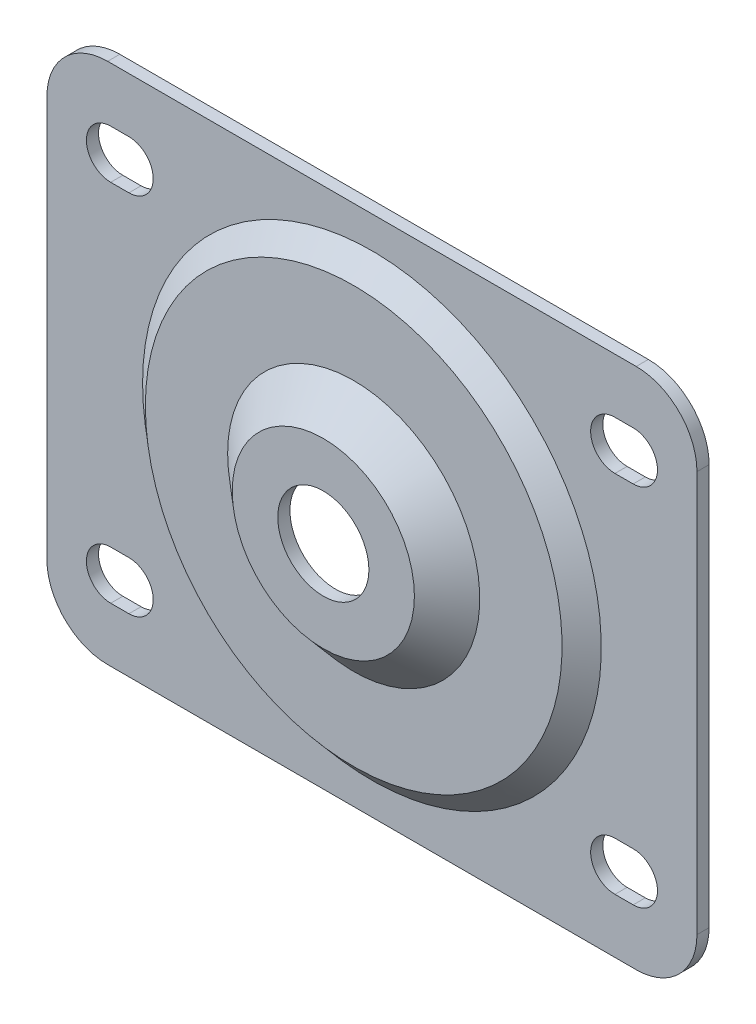
from build123d import *

# Parameters (mm, degrees)
SKETCH1_W           = 107
SKETCH1_H           = 86
BOSS_EXTRUDE1_DEPTH = 2
FILLET1_R           = 10
SKETCH5_R           = 7.5
CUT_EXTRUDE1_DEPTH  = 2


# Read off the part's stored shape, not the designer's step: Shell2
with BuildPart() as part:
    # Sketch1 → Boss-Extrude1 (new body)
    with BuildSketch(Plane.XY):
        Rectangle(SKETCH1_W, SKETCH1_H)
        with BuildLine():
            Line((-43, 34), (-40, 34))
            ThreePointArc((-40, 34), (-36, 30), (-40, 26))
            Line((-40, 26), (-43, 26))
            ThreePointArc((-43, 26), (-47, 30), (-43, 34))
        make_face(mode=Mode.SUBTRACT)
        with BuildLine():
            Line((43, 34), (40, 34))
            ThreePointArc((40, 34), (36, 30), (40, 26))
            Line((40, 26), (43, 26))
            ThreePointArc((43, 26), (47, 30), (43, 34))
        make_face(mode=Mode.SUBTRACT)
        with BuildLine():
            Line((43, -34), (40, -34))
            ThreePointArc((40, -34), (36, -30), (40, -26))
            Line((40, -26), (43, -26))
            ThreePointArc((43, -26), (47, -30), (43, -34))
        make_face(mode=Mode.SUBTRACT)
        with BuildLine():
            Line((-43, -34), (-40, -34))
            ThreePointArc((-40, -34), (-36, -30), (-40, -26))
            Line((-40, -26), (-43, -26))
            ThreePointArc((-43, -26), (-47, -30), (-43, -34))
        make_face(mode=Mode.SUBTRACT)
    extrude(amount=BOSS_EXTRUDE1_DEPTH)

    # Fillet1
    fillet1_edges = [part.edges().sort_by_distance(p)[0] for p in [
        (-53.5, 43, 1),
        (53.5, 43, 1),
        (53.5, -43, 1),
        (-53.5, -43, 1),
    ]]
    fillet(fillet1_edges, radius=FILLET1_R)

    # Sketch3 → Revolve1 (revolve)
    with BuildSketch(Plane(origin=(0, 0, 0), x_dir=(1, 0, 0), z_dir=(0, 1, 0)), mode=Mode.PRIVATE) as revolve1_sk:
        Polygon((37.75, -2), (34.294777143, -5), (20.75, -5), (14.991295238, -10), (0, -10), (0, -2), align=None)
    revolve(revolve1_sk.sketch.rotate(Axis((0, 0, 0), (0, 0, 1)), 180), axis=Axis((0, 0, 0), (0, 0, 1)))

    # Shell2 outline → Shell2 (revolve, cut)
    with BuildSketch(Plane.XZ):
        Polygon((37, 0), (37, 0.002520926), (33.547680597, 3), (20.002903454, 3), (14.244198692, 8), (0, 8), (0, 0), align=None)
    revolve(axis=Axis((0, 0, 0), (0, 0, 1)), mode=Mode.SUBTRACT)

    # Sketch5 → Cut-Extrude1 (cut)
    with BuildSketch(Plane.XY.offset(10)):
        Circle(SKETCH5_R)
    extrude(amount=-CUT_EXTRUDE1_DEPTH, mode=Mode.SUBTRACT)


solid = part.part
